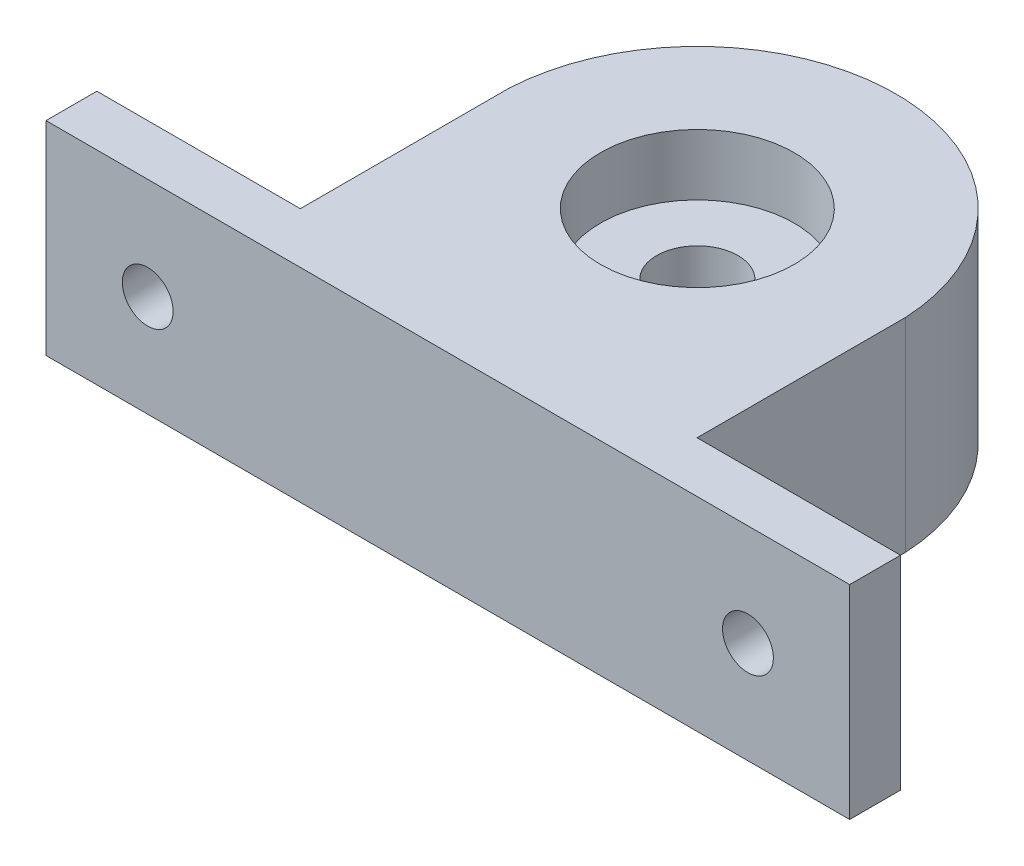
from build123d import *

# Parameters (mm, degrees)
BODY_START           = -20
BODY_OUTLINE_R       = 9.525
BODY_DEPTH           = 20
SKETCH2_R            = 2.5
MOUNTING_HOLES_DEPTH = 5
SKETCH3_R            = 9.525
SKETCH3_R_2          = 4
HOLEINSERT_DEPTH     = 14


# Read off the part's stored shape, not the designer's step: Body
with BuildPart() as part:
    # Body outline → Body (new body)
    with BuildSketch(Plane(origin=(0, 0, 0), x_dir=(1, 0, 0), z_dir=(0, 1, 0)).offset(BODY_START)):
        with BuildLine():
            Line((16.5, 2.5), (16.5, 23.012737313))
            ThreePointArc((16.5, 23.012737313), (-3, 41.55), (-22.5, 23.012737313))
            Line((-22.5, 23.012737313), (-22.5, 2.5))
            Line((-22.5, 2.5), (-42.5, 2.5))
            Line((-42.5, 2.5), (-42.5, -2.5))
            Line((-42.5, -2.5), (36.5, -2.5))
            Line((36.5, -2.5), (36.5, 2.5))
            Line((36.5, 2.5), (16.5, 2.5))
        make_face()
        with Locations((-3, 22.025)):
            Circle(BODY_OUTLINE_R, mode=Mode.SUBTRACT)
    extrude(amount=BODY_DEPTH)

    # Sketch2 → Mounting Holes (cut)
    with BuildSketch(Plane(origin=(0, 0, -2.5), x_dir=(-1, 0, 0), z_dir=(0, 0, -1))):
        with Locations((-26.5, -10)):
            Circle(SKETCH2_R)
        with Locations((32.5, -10)):
            Circle(SKETCH2_R)
    extrude(amount=-MOUNTING_HOLES_DEPTH, mode=Mode.SUBTRACT)

    # Sketch3 → HoleInsert (add)
    with BuildSketch(Plane.XZ.offset(20)):
        with Locations(Location((-3, -22.025, 0), (0, 0, 90))):
            Circle(SKETCH3_R)
        with Locations(Location((-3, -22.025, 0), (0, 0, 270))):
            Circle(SKETCH3_R_2, mode=Mode.SUBTRACT)
    extrude(amount=-HOLEINSERT_DEPTH)


solid = part.part
